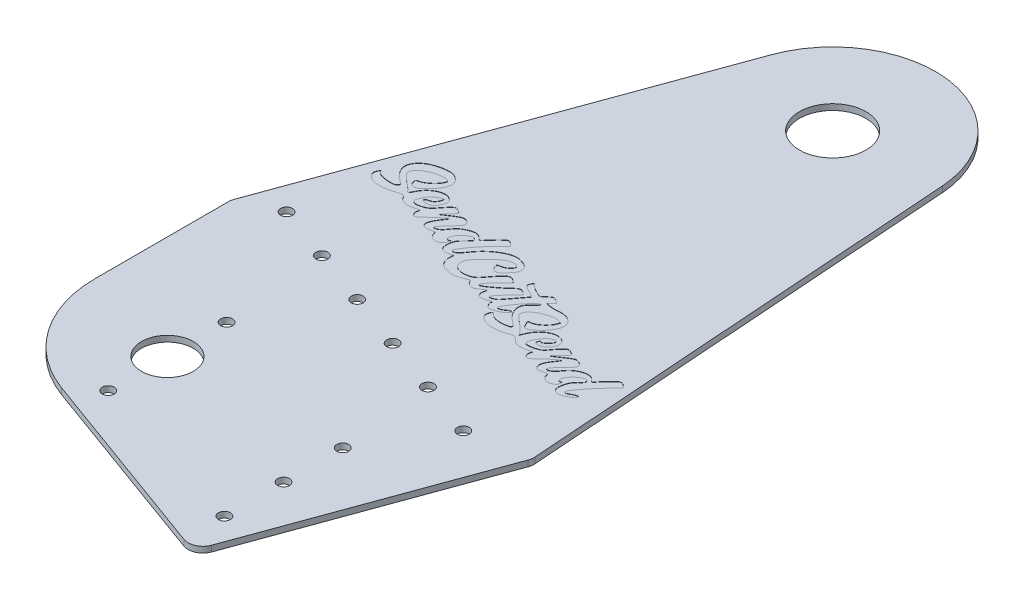
from build123d import *

# Parameters (mm, degrees)
SKETCH1_R                  = 14.2875
SKETCH1_R_2                = 11.1125
SKETCH1_R_3                = 2.5527
BOSS_EXTRUDE1_DEPTH        = 2.54
F_7_0_201_DIAMETER_HOLE1_D = 5.1054
CUT_EXTRUDE1_DEPTH         = 0.127


with BuildPart() as part:
    # Sketch1 → Boss-Extrude1 (new body)
    with BuildSketch(Plane(origin=(0, 0, 0), x_dir=(1, 0, 0), z_dir=(0, 1, 0))):
        with BuildLine():
            Line((0, 79.961539901), (0, 137.226043439))
            ThreePointArc((0, 137.226043439), (0.096470768, 138.328709367), (0.382951858, 139.397871349))
            Line((0.382951858, 139.397871349), (8.68731164, 162.213912335))
            Line((8.68731164, 162.213912335), (61.897095438, 308.406591813))
            ThreePointArc((61.897095438, 308.406591813), (109.5024689, 337.025784939), (147.412775028, 296.428513026))
            Line((147.412775028, 296.428513026), (160.751422837, 108.18172413))
            ThreePointArc((160.751422837, 108.18172413), (160.705914605, 106.852067788), (160.384352079, 105.56107804))
            Line((160.384352079, 105.56107804), (124.135089685, 5.967048142))
            ThreePointArc((124.135089685, 5.967048142), (120.851667505, 2.383821604), (115.996213633, 2.17182791))
            Line((115.996213633, 2.17182791), (33.425376719, 32.225154765))
            ThreePointArc((33.425376719, 32.225154765), (9.18707615, 50.823856935), (0, 79.961539901))
        make_face()
        with Locations((103.379027621, 293.308403239)):
            Circle(SKETCH1_R, mode=Mode.SUBTRACT)
        with Locations((44.45, 66.621712158)):
            Circle(SKETCH1_R_2, mode=Mode.SUBTRACT)
        with Locations((44.45, 92.021712158)):
            Circle(SKETCH1_R_3, mode=Mode.SUBTRACT)
        with Locations((44.45, 41.221712158)):
            Circle(SKETCH1_R_3, mode=Mode.SUBTRACT)
    extrude(amount=BOSS_EXTRUDE1_DEPTH)

    # #7 (0.201) Diameter Hole1 (through all)
    with Locations(Plane(origin=(0, 0, 0), x_dir=(-1, 0, 0), z_dir=(0, -1, 0))):
        with Locations((-135.618714944, 102.499602028), (-111.750522376, 111.186913669), (-87.882329808, 119.874225309), (-64.01413724, 128.56153695), (-40.145944672, 137.24884859), (-16.277752104, 145.936160231), (-116.079027621, 70.264108059), (-116.079027621, 44.864108059), (-116.079027621, 19.464108059)):
            Hole(F_7_0_201_DIAMETER_HOLE1_D / 2)

    # Sketch7 → Cut-Extrude1 (cut)
    with BuildSketch(Plane(origin=(0, 2.54, 0), x_dir=(1, 0, 0), z_dir=(0, 1, 0))):
        with BuildLine():
            Line((62.076099499, 169.389914878), (62.514373765, 170.567044095))
            Line((62.514373765, 170.567044095), (61.586655178, 170.262230462))
            ThreePointArc((61.586655178, 170.262230462), (60.985434818, 170.31702595), (60.613751656, 170.792757066))
            ThreePointArc((60.613751656, 170.792757066), (60.559055711, 171.624223937), (60.815399545, 172.417077419))
            ThreePointArc((60.815399545, 172.417077419), (61.639993866, 173.691529448), (62.639781612, 174.833723929))
            ThreePointArc((62.639781612, 174.833723929), (63.679633812, 175.661233826), (64.871791681, 176.248451709))
            ThreePointArc((64.871791681, 176.248451709), (65.099079856, 176.328434352), (65.328232899, 176.402905959))
            ThreePointArc((65.328232899, 176.402905959), (65.537680332, 176.464533249), (65.748990567, 176.519434385))
            ThreePointArc((65.748990567, 176.519434385), (65.925606026, 176.559822305), (66.103240098, 176.595464145))
            ThreePointArc((66.103240098, 176.595464145), (66.178363518, 176.599313759), (66.251843252, 176.583217908))
            ThreePointArc((66.251843252, 176.583217908), (66.357924451, 176.524027953), (66.440024115, 176.434494066))
            ThreePointArc((66.440024115, 176.434494066), (66.590015709, 176.197743003), (66.731621066, 175.955882575))
            ThreePointArc((66.731621066, 175.955882575), (66.865503468, 175.708537233), (66.991385724, 175.457026055))
            ThreePointArc((66.991385724, 175.457026055), (67.017480864, 175.354291121), (67.00166206, 175.249480871))
            ThreePointArc((67.00166206, 175.249480871), (66.987526619, 175.22046471), (66.967691046, 175.195003006))
            Line((66.967691046, 175.195003006), (66.479583473, 174.688563774))
            ThreePointArc((66.479583473, 174.688563774), (66.201240536, 174.401518397), (65.921664435, 174.115673959))
            ThreePointArc((65.921664435, 174.115673959), (65.593555134, 173.782552464), (65.264545463, 173.450320196))
            ThreePointArc((65.264545463, 173.450320196), (64.65377447, 172.811457395), (64.067657057, 172.149903722))
            ThreePointArc((64.067657057, 172.149903722), (63.717771309, 171.683587036), (63.428601059, 171.177373787))
            ThreePointArc((63.428601059, 171.177373787), (63.215744133, 170.658844758), (63.0742109, 170.116489922))
            ThreePointArc((63.0742109, 170.116489922), (62.944743941, 169.332574448), (62.853767959, 168.543265552))
            ThreePointArc((62.853767959, 168.543265552), (62.842100531, 167.636825959), (62.97036833, 166.739431824))
            ThreePointArc((62.97036833, 166.739431824), (63.232071984, 166.091038495), (63.688945889, 165.561728618))
            ThreePointArc((63.688945889, 165.561728618), (64.290700289, 165.209453488), (64.974100017, 165.070994336))
            ThreePointArc((64.974100017, 165.070994336), (65.87566197, 165.109953656), (66.760144194, 165.288903312))
            ThreePointArc((66.760144194, 165.288903312), (67.04136363, 165.366968009), (67.323658905, 165.441048003))
            ThreePointArc((67.323658905, 165.441048003), (67.562615268, 165.498966516), (67.802868438, 165.55124569))
            ThreePointArc((67.802868438, 165.55124569), (68.002078645, 165.591015118), (68.201710329, 165.628611723))
            ThreePointArc((68.201710329, 165.628611723), (68.234260975, 165.622293852), (68.253909944, 165.595584713))
            ThreePointArc((68.253909944, 165.595584713), (68.261610424, 165.555018283), (68.26322337, 165.513758969))
            ThreePointArc((68.26322337, 165.513758969), (68.256279887, 165.326490131), (68.248634533, 165.139248634))
            ThreePointArc((68.248634533, 165.139248634), (68.238353175, 164.919063126), (68.2263207, 164.698966365))
            ThreePointArc((68.2263207, 164.698966365), (68.210944201, 164.448389799), (68.19421696, 164.197899776))
            ThreePointArc((68.19421696, 164.197899776), (68.187930606, 163.572595343), (68.25570298, 162.950942662))
            ThreePointArc((68.25570298, 162.950942662), (68.398465468, 162.310034794), (68.606068614, 161.687102249))
            ThreePointArc((68.606068614, 161.687102249), (68.866428087, 161.113452111), (69.186141219, 160.570639944))
            ThreePointArc((69.186141219, 160.570639944), (69.525559026, 160.137603462), (69.92917637, 159.763680902))
            ThreePointArc((69.92917637, 159.763680902), (70.466971525, 159.397497396), (71.050629495, 159.10999546))
            ThreePointArc((71.050629495, 159.10999546), (71.823044361, 158.825820547), (72.613497718, 158.596553024))
            ThreePointArc((72.613497718, 158.596553024), (73.43584942, 158.41929053), (74.268555418, 158.299770517))
            ThreePointArc((74.268555418, 158.299770517), (74.978307796, 158.26418709), (75.687446785, 158.310409525))
            ThreePointArc((75.687446785, 158.310409525), (76.037646073, 158.362788338), (76.384679393, 158.433151371))
            ThreePointArc((76.384679393, 158.433151371), (76.847607887, 158.544808994), (77.308005626, 158.666481252))
            ThreePointArc((77.308005626, 158.666481252), (77.798827363, 158.807573323), (78.286518059, 158.959134316))
            ThreePointArc((78.286518059, 158.959134316), (78.731971317, 159.109578951), (79.173136741, 159.272168193))
            Line((79.173136741, 159.272168193), (81.212299551, 160.055577712))
            Line((81.212299551, 160.055577712), (81.563880431, 159.301610082))
            ThreePointArc((81.563880431, 159.301610082), (81.7858593, 158.91888467), (82.072263984, 158.581652235))
            ThreePointArc((82.072263984, 158.581652235), (82.441698725, 158.263763464), (82.85025398, 157.998023172))
            ThreePointArc((82.85025398, 157.998023172), (83.274383921, 157.798102658), (83.722059966, 157.658673185))
            ThreePointArc((83.722059966, 157.658673185), (84.113032151, 157.612820033), (84.504080666, 157.658017586))
            ThreePointArc((84.504080666, 157.658017586), (84.704717825, 157.716644143), (84.897976847, 157.796288937))
            ThreePointArc((84.897976847, 157.796288937), (85.190157795, 157.940782054), (85.477858023, 158.09400263))
            ThreePointArc((85.477858023, 158.09400263), (85.799871894, 158.278112061), (86.116229495, 158.471779517))
            ThreePointArc((86.116229495, 158.471779517), (86.425022263, 158.673917098), (86.727482456, 158.88541274))
            ThreePointArc((86.727482456, 158.88541274), (87.010268624, 159.085729074), (87.296697387, 159.280801403))
            ThreePointArc((87.296697387, 159.280801403), (87.551055536, 159.445614583), (87.809847455, 159.603374512))
            ThreePointArc((87.809847455, 159.603374512), (88.025908058, 159.728525444), (88.244111159, 159.849902321))
            ThreePointArc((88.244111159, 159.849902321), (88.311309966, 159.870360992), (88.381119582, 159.862560067))
            ThreePointArc((88.381119582, 159.862560067), (88.424417108, 159.831307094), (88.441443645, 159.780695621))
            ThreePointArc((88.441443645, 159.780695621), (88.438680387, 159.659394972), (88.427011598, 159.538625264))
            ThreePointArc((88.427011598, 159.538625264), (88.400044033, 159.378215621), (88.362408415, 159.219968778))
            ThreePointArc((88.362408415, 159.219968778), (88.308041388, 159.036094227), (88.246173408, 158.854605998))
            ThreePointArc((88.246173408, 158.854605998), (88.175764463, 158.628210163), (88.127170775, 158.396151663))
            ThreePointArc((88.127170775, 158.396151663), (88.098728957, 158.152181729), (88.091257596, 157.906673186))
            ThreePointArc((88.091257596, 157.906673186), (88.104822915, 157.659437476), (88.139289533, 157.414240481))
            ThreePointArc((88.139289533, 157.414240481), (88.194014788, 157.177184715), (88.269735862, 156.945977862))
            ThreePointArc((88.269735862, 156.945977862), (88.380437253, 156.679086332), (88.507919452, 156.419790794))
            ThreePointArc((88.507919452, 156.419790794), (88.615909536, 156.257826396), (88.753714773, 156.120334429))
            ThreePointArc((88.753714773, 156.120334429), (88.915784478, 156.012693649), (89.095825489, 155.938948406))
            ThreePointArc((89.095825489, 155.938948406), (89.376240848, 155.864830339), (89.660777024, 155.808568217))
            ThreePointArc((89.660777024, 155.808568217), (89.907920432, 155.781557113), (90.156535471, 155.781719803))
            ThreePointArc((90.156535471, 155.781719803), (90.485680573, 155.80787544), (90.813201085, 155.849719552))
            ThreePointArc((90.813201085, 155.849719552), (91.163543927, 155.911391039), (91.510635431, 155.98930745))
            ThreePointArc((91.510635431, 155.98930745), (91.830199709, 156.078714611), (92.144110277, 156.186302363))
            ThreePointArc((92.144110277, 156.186302363), (92.681338675, 156.383695853), (93.221187384, 156.573806124))
            ThreePointArc((93.221187384, 156.573806124), (93.434095585, 156.628177121), (93.653016441, 156.647144616))
            ThreePointArc((93.653016441, 156.647144616), (93.754036745, 156.609731345), (93.805444538, 156.515063011))
            ThreePointArc((93.805444538, 156.515063011), (93.808105803, 156.352363177), (93.771443442, 156.193825518))
            ThreePointArc((93.771443442, 156.193825518), (93.715659786, 155.904517852), (93.752887622, 155.612242588))
            ThreePointArc((93.752887622, 155.612242588), (93.896843837, 155.202262562), (94.08290181, 154.809592925))
            ThreePointArc((94.08290181, 154.809592925), (94.313870713, 154.430567244), (94.583212677, 154.077775509))
            ThreePointArc((94.583212677, 154.077775509), (94.823690403, 153.859504625), (95.111996182, 153.710000468))
            ThreePointArc((95.111996182, 153.710000468), (95.607872144, 153.593770139), (96.117173812, 153.597547578))
            ThreePointArc((96.117173812, 153.597547578), (96.843705893, 153.720307082), (97.557690249, 153.902365033))
            ThreePointArc((97.557690249, 153.902365033), (98.335046392, 154.168977084), (99.088878044, 154.496242111))
            ThreePointArc((99.088878044, 154.496242111), (99.773408406, 154.866460909), (100.420507831, 155.298787301))
            ThreePointArc((100.420507831, 155.298787301), (100.716452806, 155.524575924), (101.004960086, 155.759793865))
            ThreePointArc((101.004960086, 155.759793865), (101.250782645, 155.97699109), (101.48611788, 156.205509562))
            ThreePointArc((101.48611788, 156.205509562), (101.665501212, 156.395781806), (101.836888038, 156.593287407))
            ThreePointArc((101.836888038, 156.593287407), (101.884060405, 156.686280792), (101.886160455, 156.790533329))
            ThreePointArc((101.886160455, 156.790533329), (101.81113355, 156.983449256), (101.677199582, 157.14126967))
            ThreePointArc((101.677199582, 157.14126967), (101.505007354, 157.237514751), (101.309348253, 157.262630389))
            ThreePointArc((101.309348253, 157.262630389), (101.037569291, 157.21498634), (100.782780536, 157.109078598))
            ThreePointArc((100.782780536, 157.109078598), (100.450500741, 156.907569441), (100.135844533, 156.679518408))
            ThreePointArc((100.135844533, 156.679518408), (99.724983312, 156.380037844), (99.292414052, 156.112868635))
            ThreePointArc((99.292414052, 156.112868635), (98.844251929, 155.881976338), (98.379358973, 155.686950495))
            ThreePointArc((98.379358973, 155.686950495), (97.986884432, 155.557588707), (97.585414162, 155.459648117))
            ThreePointArc((97.585414162, 155.459648117), (97.387336486, 155.474704309), (97.22647781, 155.591263053))
            ThreePointArc((97.22647781, 155.591263053), (97.073438636, 155.972384191), (97.151320841, 156.375631847))
            ThreePointArc((97.151320841, 156.375631847), (97.711080171, 157.407320056), (98.311678059, 158.415780886))
            ThreePointArc((98.311678059, 158.415780886), (99.130040127, 159.662563501), (100.006520267, 160.869197633))
            ThreePointArc((100.006520267, 160.869197633), (101.072241046, 162.221774298), (102.179192847, 163.540820213))
            ThreePointArc((102.179192847, 163.540820213), (102.84356579, 164.298754642), (103.517113714, 165.048547413))
            ThreePointArc((103.517113714, 165.048547413), (103.884004143, 165.423555591), (104.277261584, 165.77081386))
            ThreePointArc((104.277261584, 165.77081386), (104.534381399, 165.949071167), (104.816796154, 166.083712069))
            ThreePointArc((104.816796154, 166.083712069), (105.05023939, 166.127613774), (105.284320675, 166.087252201))
            ThreePointArc((105.284320675, 166.087252201), (105.351659622, 166.02133717), (105.346459612, 165.927250588))
            ThreePointArc((105.346459612, 165.927250588), (105.228966793, 165.724553402), (105.093938218, 165.533090623))
            ThreePointArc((105.093938218, 165.533090623), (104.848307764, 165.232899017), (104.586793218, 164.946438789))
            ThreePointArc((104.586793218, 164.946438789), (104.173603076, 164.524654833), (103.753608968, 164.109645497))
            ThreePointArc((103.753608968, 164.109645497), (103.049424787, 163.39758697), (102.373776531, 162.658396777))
            ThreePointArc((102.373776531, 162.658396777), (101.989554803, 162.152235076), (101.681460774, 161.596443683))
            ThreePointArc((101.681460774, 161.596443683), (101.505079191, 161.093387977), (101.429381832, 160.565708703))
            ThreePointArc((101.429381832, 160.565708703), (101.436881761, 159.925999415), (101.516888319, 159.291268629))
            ThreePointArc((101.516888319, 159.291268629), (101.712260535, 158.518519555), (102.006780565, 157.777864855))
            ThreePointArc((102.006780565, 157.777864855), (102.418510136, 157.014758189), (102.905634033, 156.297427489))
            ThreePointArc((102.905634033, 156.297427489), (103.545814214, 155.521894306), (104.249740812, 154.803723208))
            ThreePointArc((104.249740812, 154.803723208), (105.148760412, 154.002786367), (106.086684632, 153.247780257))
            ThreePointArc((106.086684632, 153.247780257), (106.643076504, 152.78422981), (107.158763253, 152.275783048))
            ThreePointArc((107.158763253, 152.275783048), (107.302662315, 151.970761825), (107.242679003, 151.638877977))
            ThreePointArc((107.242679003, 151.638877977), (106.985390772, 151.336449321), (106.625012421, 151.169752677))
            ThreePointArc((106.625012421, 151.169752677), (105.72515923, 150.99386554), (104.817927042, 150.861193732))
            ThreePointArc((104.817927042, 150.861193732), (103.87665349, 150.78105085), (102.93204479, 150.7695102))
            ThreePointArc((102.93204479, 150.7695102), (102.076114542, 150.831742405), (101.230216237, 150.976467991))
            ThreePointArc((101.230216237, 150.976467991), (100.514797012, 151.177390219), (99.826264326, 151.456884674))
            ThreePointArc((99.826264326, 151.456884674), (99.295254596, 151.773539428), (98.834592795, 152.185889125))
            ThreePointArc((98.834592795, 152.185889125), (98.552759387, 152.472909033), (98.253253444, 152.741435916))
            ThreePointArc((98.253253444, 152.741435916), (98.086978421, 152.821730169), (97.902549393, 152.812758882))
            ThreePointArc((97.902549393, 152.812758882), (97.728552417, 152.716259907), (97.60855714, 152.55755221))
            ThreePointArc((97.60855714, 152.55755221), (97.420718054, 152.132837525), (97.252129042, 151.700120723))
            ThreePointArc((97.252129042, 151.700120723), (97.120424975, 150.565164824), (97.513877685, 149.492473899))
            ThreePointArc((97.513877685, 149.492473899), (98.408438388, 148.50652004), (99.556768109, 147.832960305))
            ThreePointArc((99.556768109, 147.832960305), (101.308303959, 147.323477375), (103.124764291, 147.156376954))
            ThreePointArc((103.124764291, 147.156376954), (105.245384828, 147.294030918), (107.333578758, 147.688272195))
            ThreePointArc((107.333578758, 147.688272195), (107.725435366, 147.790413186), (108.115716391, 147.898418298))
            ThreePointArc((108.115716391, 147.898418298), (108.487933307, 148.007879151), (108.858227012, 148.123679339))
            ThreePointArc((108.858227012, 148.123679339), (109.170509291, 148.226990027), (109.481128247, 148.335199014))
            ThreePointArc((109.481128247, 148.335199014), (109.640411583, 148.400591836), (109.792936824, 148.480488349))
            ThreePointArc((109.792936824, 148.480488349), (110.158362903, 148.638407948), (110.550997631, 148.704079779))
            ThreePointArc((110.550997631, 148.704079779), (110.999125007, 148.685902264), (111.43768483, 148.592020158))
            ThreePointArc((111.43768483, 148.592020158), (111.891154812, 148.414255605), (112.311725267, 148.168581526))
            ThreePointArc((112.311725267, 148.168581526), (112.696235589, 147.857436079), (113.030584263, 147.492921826))
            ThreePointArc((113.030584263, 147.492921826), (113.516831783, 146.980166752), (114.087617379, 146.563563562))
            ThreePointArc((114.087617379, 146.563563562), (114.742714912, 146.241018694), (115.441794807, 146.030127086))
            ThreePointArc((115.441794807, 146.030127086), (116.248690267, 145.917044808), (117.063465472, 145.92008631))
            ThreePointArc((117.063465472, 145.92008631), (117.991499847, 146.03453308), (118.904500074, 146.236464873))
            ThreePointArc((118.904500074, 146.236464873), (119.297661297, 146.341504028), (119.691667626, 146.443327325))
            ThreePointArc((119.691667626, 146.443327325), (120.035021937, 146.5282979), (120.379405753, 146.608994675))
            ThreePointArc((120.379405753, 146.608994675), (120.673320865, 146.675133892), (120.967577729, 146.739735648))
            ThreePointArc((120.967577729, 146.739735648), (121.024521021, 146.743891795), (121.080380151, 146.732077835))
            ThreePointArc((121.080380151, 146.732077835), (121.112505525, 146.706664237), (121.123079645, 146.667090526))
            ThreePointArc((121.123079645, 146.667090526), (121.113780348, 146.559677634), (121.098643601, 146.452930807))
            ThreePointArc((121.098643601, 146.452930807), (121.07098753, 146.313741898), (121.035576636, 146.176321088))
            ThreePointArc((121.035576636, 146.176321088), (120.986573854, 146.016456643), (120.932098511, 145.858373279))
            ThreePointArc((120.932098511, 145.858373279), (120.837360998, 145.489763963), (120.815840825, 145.109783824))
            ThreePointArc((120.815840825, 145.109783824), (120.866288682, 144.717472677), (120.983868221, 144.339811355))
            ThreePointArc((120.983868221, 144.339811355), (121.160273571, 144.000288698), (121.394848413, 143.698015434))
            ThreePointArc((121.394848413, 143.698015434), (121.661791467, 143.471981185), (121.974137022, 143.314531733))
            ThreePointArc((121.974137022, 143.314531733), (122.191255905, 143.27080428), (122.411585207, 143.293336446))
            ThreePointArc((122.411585207, 143.293336446), (122.666552514, 143.382514468), (122.902959636, 143.513177088))
            ThreePointArc((122.902959636, 143.513177088), (123.258014552, 143.771039957), (123.591900519, 144.055780914))
            ThreePointArc((123.591900519, 144.055780914), (124.205225206, 144.629089171), (124.810961758, 145.210409014))
            ThreePointArc((124.810961758, 145.210409014), (125.635334133, 145.988621079), (126.482379095, 146.742092154))
            ThreePointArc((126.482379095, 146.742092154), (127.433022204, 147.544412744), (128.401415584, 148.325216761))
            ThreePointArc((128.401415584, 148.325216761), (129.340999876, 149.05981006), (130.286125134, 149.787260541))
            ThreePointArc((130.286125134, 149.787260541), (130.428120067, 149.816862578), (130.540190561, 149.724780841))
            ThreePointArc((130.540190561, 149.724780841), (130.54915896, 149.678093587), (130.534959016, 149.632722964))
            ThreePointArc((130.534959016, 149.632722964), (130.380262306, 149.382226807), (130.223884804, 149.132776463))
            ThreePointArc((130.223884804, 149.132776463), (130.036067178, 148.841001036), (129.843247508, 148.552506779))
            ThreePointArc((129.843247508, 148.552506779), (129.613486233, 148.218988797), (129.380109321, 147.887990754))
            ThreePointArc((129.380109321, 147.887990754), (128.803092446, 147.033618331), (128.27048311, 146.150879408))
            ThreePointArc((128.27048311, 146.150879408), (127.895820956, 145.410994732), (127.594715563, 144.638248587))
            ThreePointArc((127.594715563, 144.638248587), (127.428110444, 144.009827214), (127.342845277, 143.365311474))
            ThreePointArc((127.342845277, 143.365311474), (127.372858534, 142.851054772), (127.530162234, 142.360528222))
            ThreePointArc((127.530162234, 142.360528222), (127.743377535, 141.978324248), (128.009594669, 141.630949696))
            ThreePointArc((128.009594669, 141.630949696), (128.272849151, 141.410270087), (128.588685294, 141.275177741))
            ThreePointArc((128.588685294, 141.275177741), (129.003068119, 141.209884575), (129.422118811, 141.229193665))
            ThreePointArc((129.422118811, 141.229193665), (130.112073874, 141.348499995), (130.795504822, 141.500796182))
            ThreePointArc((130.795504822, 141.500796182), (131.340854328, 141.632133735), (131.887974943, 141.755886185))
            ThreePointArc((131.887974943, 141.755886185), (132.110954322, 141.787184366), (132.33610154, 141.784336659))
            ThreePointArc((132.33610154, 141.784336659), (132.47510977, 141.743288509), (132.587447099, 141.651699407))
            ThreePointArc((132.587447099, 141.651699407), (132.691105365, 141.497311977), (132.763030106, 141.325826274))
            ThreePointArc((132.763030106, 141.325826274), (132.799309063, 141.201126834), (132.831341733, 141.075269688))
            ThreePointArc((132.831341733, 141.075269688), (132.857559922, 140.953957695), (132.879045209, 140.831718685))
            ThreePointArc((132.879045209, 140.831718685), (132.893187091, 140.728099081), (132.903399618, 140.624018729))
            ThreePointArc((132.903399618, 140.624018729), (132.902402893, 140.565828987), (132.89031835, 140.508899175))
            ThreePointArc((132.89031835, 140.508899175), (132.88403432, 140.448738527), (132.901802285, 140.390919049))
            ThreePointArc((132.901802285, 140.390919049), (132.972760394, 140.267087378), (133.048878371, 140.146358799))
            ThreePointArc((133.048878371, 140.146358799), (133.150312005, 140.000349967), (133.258503186, 139.859275414))
            ThreePointArc((133.258503186, 139.859275414), (133.38618993, 139.705960386), (133.518918559, 139.556988867))
            ThreePointArc((133.518918559, 139.556988867), (133.883912329, 139.221748466), (134.299490846, 138.951746476))
            ThreePointArc((134.299490846, 138.951746476), (134.738976146, 138.766257322), (135.205264922, 138.665617709))
            ThreePointArc((135.205264922, 138.665617709), (135.714708551, 138.648358864), (136.219686472, 138.717842513))
            ThreePointArc((136.219686472, 138.717842513), (136.779359384, 138.878487417), (137.316911747, 139.10226858))
            ThreePointArc((137.316911747, 139.10226858), (137.672278656, 139.28361384), (138.020147338, 139.478957443))
            ThreePointArc((138.020147338, 139.478957443), (138.214734471, 139.616723249), (138.383376821, 139.785256116))
            ThreePointArc((138.383376821, 139.785256116), (138.507214208, 139.965861807), (138.592633253, 140.167499356))
            ThreePointArc((138.592633253, 140.167499356), (138.676354824, 140.474412062), (138.738886243, 140.786332776))
            ThreePointArc((138.738886243, 140.786332776), (138.777596283, 141.046627531), (138.807965465, 141.308026728))
            ThreePointArc((138.807965465, 141.308026728), (138.809051652, 141.447230947), (138.784685445, 141.584290359))
            ThreePointArc((138.784685445, 141.584290359), (138.745048863, 141.651198822), (138.676875391, 141.688617785))
            ThreePointArc((138.676875391, 141.688617785), (138.585042426, 141.694793904), (138.496299921, 141.67037658))
            ThreePointArc((138.496299921, 141.67037658), (138.245223556, 141.585322888), (137.981654009, 141.556958025))
            ThreePointArc((137.981654009, 141.556958025), (137.746132159, 141.593136163), (137.531802951, 141.69726296))
            ThreePointArc((137.531802951, 141.69726296), (137.360364669, 141.858574596), (137.245409363, 142.063995642))
            ThreePointArc((137.245409363, 142.063995642), (137.18320656, 142.315734486), (137.180101878, 142.575025818))
            ThreePointArc((137.180101878, 142.575025818), (137.318540497, 143.243918965), (137.588269285, 143.871477468))
            ThreePointArc((137.588269285, 143.871477468), (138.048267581, 144.611142741), (138.579131623, 145.301712446))
            ThreePointArc((138.579131623, 145.301712446), (139.224928904, 145.992508541), (139.932530151, 146.619847242))
            ThreePointArc((139.932530151, 146.619847242), (140.663482607, 147.146469272), (141.447089395, 147.590971978))
            ThreePointArc((141.447089395, 147.590971978), (141.872271249, 147.782255207), (142.311086237, 147.93976803))
            ThreePointArc((142.311086237, 147.93976803), (142.630008443, 148.002843003), (142.955003685, 147.994601769))
            ThreePointArc((142.955003685, 147.994601769), (143.20423146, 147.918838999), (143.417138064, 147.768754825))
            ThreePointArc((143.417138064, 147.768754825), (143.602089362, 147.541857009), (143.731276534, 147.279177973))
            ThreePointArc((143.731276534, 147.279177973), (143.769430929, 147.102790992), (143.760730689, 146.922534423))
            ThreePointArc((143.760730689, 146.922534423), (143.706341112, 146.732608649), (143.615285256, 146.557283645))
            ThreePointArc((143.615285256, 146.557283645), (143.435526815, 146.309397921), (143.23267276, 146.08002778))
            ThreePointArc((143.23267276, 146.08002778), (142.830658796, 145.674592106), (142.421668394, 145.276195114))
            ThreePointArc((142.421668394, 145.276195114), (142.049761052, 144.907611824), (141.690834097, 144.526376788))
            ThreePointArc((141.690834097, 144.526376788), (141.406907884, 144.194880868), (141.143163573, 143.847112873))
            ThreePointArc((141.143163573, 143.847112873), (140.925300595, 143.518409075), (140.730159599, 143.175727801))
            ThreePointArc((140.730159599, 143.175727801), (140.558754173, 142.821014031), (140.411620314, 142.455564574))
            ThreePointArc((140.411620314, 142.455564574), (140.000754527, 141.089005923), (139.748020584, 139.684577642))
            ThreePointArc((139.748020584, 139.684577642), (139.77462793, 138.657888358), (140.097521147, 137.68293256))
            ThreePointArc((140.097521147, 137.68293256), (140.617787708, 137.039476121), (141.357571381, 136.668755742))
            ThreePointArc((141.357571381, 136.668755742), (142.34158636, 136.545808903), (143.324901769, 136.674230896))
            ThreePointArc((143.324901769, 136.674230896), (143.930823572, 136.866099184), (144.514705648, 137.117169677))
            ThreePointArc((144.514705648, 137.117169677), (145.230560932, 137.490228301), (145.927205287, 137.898037283))
            ThreePointArc((145.927205287, 137.898037283), (146.567178533, 138.312514771), (147.189611838, 138.752894295))
            ThreePointArc((147.189611838, 138.752894295), (147.450320588, 139.012164188), (147.625121538, 139.335636841))
            ThreePointArc((147.625121538, 139.335636841), (147.66831646, 139.580039315), (147.625508861, 139.824509927))
            ThreePointArc((147.625508861, 139.824509927), (147.503357877, 139.981601939), (147.312279747, 140.037170916))
            ThreePointArc((147.312279747, 140.037170916), (146.92809182, 139.988948235), (146.559791781, 139.869445636))
            ThreePointArc((146.559791781, 139.869445636), (145.919183771, 139.578507829), (145.28953141, 139.264563035))
            ThreePointArc((145.28953141, 139.264563035), (144.757539042, 138.992974164), (144.22094649, 138.730591183))
            ThreePointArc((144.22094649, 138.730591183), (143.922050443, 138.604340218), (143.612717838, 138.506404054))
            ThreePointArc((143.612717838, 138.506404054), (143.429336658, 138.478951945), (143.244425211, 138.492737159))
            ThreePointArc((143.244425211, 138.492737159), (143.113889341, 138.550874973), (143.023413568, 138.661481271))
            ThreePointArc((143.023413568, 138.661481271), (142.91191489, 139.241621041), (143.106379668, 139.799453954))
            ThreePointArc((143.106379668, 139.799453954), (144.286575141, 141.488273337), (145.50646037, 143.148650492))
            ThreePointArc((145.50646037, 143.148650492), (146.980693912, 145.031699337), (148.524436393, 146.858197803))
            ThreePointArc((148.524436393, 146.858197803), (150.184655417, 148.685845904), (151.906041971, 150.456002145))
            ThreePointArc((151.906041971, 150.456002145), (152.504712321, 151.05737518), (153.096993047, 151.665042242))
            ThreePointArc((153.096993047, 151.665042242), (153.389903577, 151.989224041), (153.661121274, 152.331760723))
            ThreePointArc((153.661121274, 152.331760723), (153.792302325, 152.53993542), (153.89094745, 152.765355721))
            ThreePointArc((153.89094745, 152.765355721), (153.90512711, 152.924465028), (153.841665685, 153.071057941))
            ThreePointArc((153.841665685, 153.071057941), (153.63076883, 153.307554056), (153.388535752, 153.511835802))
            ThreePointArc((153.388535752, 153.511835802), (153.034906948, 153.75383123), (152.667620166, 153.9745472))
            ThreePointArc((152.667620166, 153.9745472), (152.299035602, 154.167935516), (151.920065442, 154.340084405))
            ThreePointArc((151.920065442, 154.340084405), (151.667742237, 154.416522646), (151.405080505, 154.43929586))
            ThreePointArc((151.405080505, 154.43929586), (151.107033916, 154.380132563), (150.848489758, 154.220486129))
            ThreePointArc((150.848489758, 154.220486129), (150.045484913, 153.488321327), (149.253554949, 152.744191627))
            ThreePointArc((149.253554949, 152.744191627), (148.412258991, 151.919459439), (147.593814846, 151.072044988))
            ThreePointArc((147.593814846, 151.072044988), (146.861074406, 150.264879087), (146.156594083, 149.432933886))
            ThreePointArc((146.156594083, 149.432933886), (145.799826775, 149.012010308), (145.428383475, 148.603979125))
            ThreePointArc((145.428383475, 148.603979125), (145.233235441, 148.450619015), (145.001743187, 148.361101335))
            ThreePointArc((145.001743187, 148.361101335), (144.804298959, 148.366712064), (144.633488365, 148.465906036))
            ThreePointArc((144.633488365, 148.465906036), (144.402784663, 148.718365182), (144.201416649, 148.994790112))
            ThreePointArc((144.201416649, 148.994790112), (143.893819361, 149.366783603), (143.508494648, 149.657507036))
            ThreePointArc((143.508494648, 149.657507036), (143.005365737, 149.903183673), (142.471047773, 150.070515752))
            ThreePointArc((142.471047773, 150.070515752), (141.847143727, 150.17256117), (141.215236443, 150.191606156))
            ThreePointArc((141.215236443, 150.191606156), (140.544397774, 150.130740879), (139.8841922, 149.997108165))
            ThreePointArc((139.8841922, 149.997108165), (139.076782429, 149.74477526), (138.297656698, 149.415312775))
            ThreePointArc((138.297656698, 149.415312775), (137.547232874, 149.007701472), (136.840246687, 148.528688505))
            ThreePointArc((136.840246687, 148.528688505), (136.143749993, 147.954086887), (135.502156046, 147.318766597))
            ThreePointArc((135.502156046, 147.318766597), (134.847038506, 146.559396239), (134.243649891, 145.758306662))
            ThreePointArc((134.243649891, 145.758306662), (133.893244575, 145.273954818), (133.529532139, 144.799514244))
            ThreePointArc((133.529532139, 144.799514244), (133.245270633, 144.463255266), (132.938900504, 144.14700845))
            ThreePointArc((132.938900504, 144.14700845), (132.668863383, 143.908783705), (132.378720527, 143.695504077))
            ThreePointArc((132.378720527, 143.695504077), (132.083061832, 143.518862205), (131.770999635, 143.373144673))
            ThreePointArc((131.770999635, 143.373144673), (131.251102987, 143.231020131), (130.7123491, 143.215652636))
            ThreePointArc((130.7123491, 143.215652636), (130.456459221, 143.376064517), (130.434657545, 143.677289166))
            ThreePointArc((130.434657545, 143.677289166), (130.79629879, 144.373155677), (131.266993719, 145.000420274))
            ThreePointArc((131.266993719, 145.000420274), (132.330651746, 146.169433975), (133.422645412, 147.312023693))
            ThreePointArc((133.422645412, 147.312023693), (134.334576492, 148.260561838), (135.228722139, 149.22588379))
            ThreePointArc((135.228722139, 149.22588379), (135.670578435, 149.76697259), (136.052634617, 150.351820561))
            ThreePointArc((136.052634617, 150.351820561), (136.222271275, 150.746269165), (136.293749123, 151.169656946))
            ThreePointArc((136.293749123, 151.169656946), (136.24891505, 151.551653984), (136.082974398, 151.898634577))
            ThreePointArc((136.082974398, 151.898634577), (135.842309839, 152.185418226), (135.555407376, 152.425941132))
            ThreePointArc((135.555407376, 152.425941132), (135.174655315, 152.664106697), (134.771529919, 152.862058418))
            ThreePointArc((134.771529919, 152.862058418), (134.349950544, 153.017909899), (133.914671256, 153.12994023))
            ThreePointArc((133.914671256, 153.12994023), (133.539517988, 153.173283696), (133.162472776, 153.15194036))
            ThreePointArc((133.162472776, 153.15194036), (132.967401977, 153.105618875), (132.783906264, 153.024825186))
            ThreePointArc((132.783906264, 153.024825186), (132.320523031, 152.763926317), (131.860956605, 152.496361483))
            ThreePointArc((131.860956605, 152.496361483), (131.314576086, 152.165822299), (130.774642484, 151.824853783))
            ThreePointArc((130.774642484, 151.824853783), (130.186534276, 151.439485158), (129.604043274, 151.045677497))
            ThreePointArc((129.604043274, 151.045677497), (129.0380303, 150.659002789), (128.470194026, 150.275010623))
            ThreePointArc((128.470194026, 150.275010623), (127.985533996, 149.951630549), (127.498404455, 149.631982576))
            ThreePointArc((127.498404455, 149.631982576), (127.069171885, 149.35312271), (126.639533754, 149.074888097))
            ThreePointArc((126.639533754, 149.074888097), (126.601736189, 149.061381298), (126.561878385, 149.066118917))
            ThreePointArc((126.561878385, 149.066118917), (126.519441608, 149.112579103), (126.533354922, 149.173945614))
            ThreePointArc((126.533354922, 149.173945614), (126.776839878, 149.455616663), (127.024963385, 149.733210304))
            ThreePointArc((127.024963385, 149.733210304), (127.405118202, 150.143104412), (127.793458679, 150.545251822))
            ThreePointArc((127.793458679, 150.545251822), (128.443193982, 151.201436475), (129.096131622, 151.854434716))
            ThreePointArc((129.096131622, 151.854434716), (129.422147348, 152.1855279), (129.741391067, 152.523155504))
            ThreePointArc((129.741391067, 152.523155504), (130.008357891, 152.820613552), (130.265754739, 153.126390331))
            ThreePointArc((130.265754739, 153.126390331), (130.468598756, 153.380419403), (130.66631701, 153.638458077))
            ThreePointArc((130.66631701, 153.638458077), (130.696681066, 153.71693357), (130.681612317, 153.799718302))
            ThreePointArc((130.681612317, 153.799718302), (130.513805756, 154.059802226), (130.289700263, 154.273295592))
            ThreePointArc((130.289700263, 154.273295592), (129.888084675, 154.554403353), (129.469241351, 154.809132471))
            ThreePointArc((129.469241351, 154.809132471), (129.037159996, 155.035529524), (128.591630923, 155.234159252))
            ThreePointArc((128.591630923, 155.234159252), (128.308873538, 155.307936492), (128.016663681, 155.30506962))
            ThreePointArc((128.016663681, 155.30506962), (127.675515083, 155.208794621), (127.371572214, 155.026394035))
            ThreePointArc((127.371572214, 155.026394035), (126.914414526, 154.638368883), (126.481808336, 154.223147792))
            ThreePointArc((126.481808336, 154.223147792), (125.925804301, 153.627075081), (125.399927858, 153.0042612))
            ThreePointArc((125.399927858, 153.0042612), (124.740208565, 152.16351677), (124.099423449, 151.308253549))
            ThreePointArc((124.099423449, 151.308253549), (123.724228696, 150.811126337), (123.334605023, 150.325225154))
            ThreePointArc((123.334605023, 150.325225154), (123.048901317, 150.00871762), (122.736636312, 149.718382996))
            ThreePointArc((122.736636312, 149.718382996), (122.436752073, 149.489616658), (122.114110255, 149.294253277))
            ThreePointArc((122.114110255, 149.294253277), (121.711829563, 149.095530103), (121.29765337, 148.922964939))
            ThreePointArc((121.29765337, 148.922964939), (120.659304634, 148.699002971), (120.010438186, 148.507638384))
            ThreePointArc((120.010438186, 148.507638384), (119.37505065, 148.356621233), (118.732177837, 148.241564523))
            ThreePointArc((118.732177837, 148.241564523), (118.176205551, 148.175013483), (117.617253826, 148.14173898))
            ThreePointArc((117.617253826, 148.14173898), (117.243952185, 148.166056377), (116.8818991, 148.260199959))
            ThreePointArc((116.8818991, 148.260199959), (116.319932985, 148.741962649), (116.214583653, 149.47463087))
            ThreePointArc((116.214583653, 149.47463087), (116.60072466, 150.752073494), (117.177555711, 151.955497973))
            ThreePointArc((117.177555711, 151.955497973), (118.056127979, 153.278075265), (119.093145332, 154.480445812))
            ThreePointArc((119.093145332, 154.480445812), (120.071406475, 155.255083734), (121.212607105, 155.759781562))
            ThreePointArc((121.212607105, 155.759781562), (121.455803326, 155.826498165), (121.70169492, 155.882469862))
            ThreePointArc((121.70169492, 155.882469862), (121.856640009, 155.900603002), (122.012413479, 155.892152139))
            ThreePointArc((122.012413479, 155.892152139), (122.12417889, 155.859942129), (122.222560976, 155.797894107))
            ThreePointArc((122.222560976, 155.797894107), (122.310347198, 155.705418591), (122.376342165, 155.596318608))
            ThreePointArc((122.376342165, 155.596318608), (122.465799468, 155.113625285), (122.310019044, 154.648084833))
            ThreePointArc((122.310019044, 154.648084833), (121.79737103, 153.943528817), (121.213016628, 153.297202973))
            ThreePointArc((121.213016628, 153.297202973), (120.583078485, 152.736212145), (119.895254868, 152.247917722))
            ThreePointArc((119.895254868, 152.247917722), (119.473802154, 152.143525441), (119.073222089, 152.311023948))
            ThreePointArc((119.073222089, 152.311023948), (118.994620111, 152.360824369), (118.904776298, 152.385040932))
            ThreePointArc((118.904776298, 152.385040932), (118.822245122, 152.377019148), (118.750112464, 152.336121428))
            ThreePointArc((118.750112464, 152.336121428), (118.66486315, 152.243694567), (118.599791895, 152.136103201))
            ThreePointArc((118.599791895, 152.136103201), (118.513895102, 151.943669037), (118.437161537, 151.74740104))
            ThreePointArc((118.437161537, 151.74740104), (118.359078816, 151.512782829), (118.294176274, 151.274182167))
            ThreePointArc((118.294176274, 151.274182167), (118.281425769, 151.138616674), (118.307696163, 151.005011118))
            ThreePointArc((118.307696163, 151.005011118), (118.368666552, 150.896784681), (118.463039508, 150.816012811))
            ThreePointArc((118.463039508, 150.816012811), (118.63984408, 150.722389447), (118.824498663, 150.645396746))
            ThreePointArc((118.824498663, 150.645396746), (119.712133307, 150.468839232), (120.611777752, 150.567366832))
            ThreePointArc((120.611777752, 150.567366832), (121.559752733, 150.935454355), (122.406165527, 151.499130123))
            ThreePointArc((122.406165527, 151.499130123), (123.158398535, 152.269068078), (123.740963324, 153.174207415))
            ThreePointArc((123.740963324, 153.174207415), (124.100558976, 154.140488281), (124.231077365, 155.163216347))
            ThreePointArc((124.231077365, 155.163216347), (124.201819365, 155.597953864), (124.104128215, 156.022582147))
            ThreePointArc((124.104128215, 156.022582147), (123.943871166, 156.402369593), (123.715660286, 156.745648809))
            ThreePointArc((123.715660286, 156.745648809), (123.406690703, 157.06805043), (123.048313637, 157.334454046))
            ThreePointArc((123.048313637, 157.334454046), (122.585124198, 157.590441635), (122.098427004, 157.798287594))
            ThreePointArc((122.098427004, 157.798287594), (121.257951678, 158.021478208), (120.390646571, 158.084681655))
            ThreePointArc((120.390646571, 158.084681655), (119.46559047, 157.994391583), (118.565162323, 157.763934991))
            ThreePointArc((118.565162323, 157.763934991), (117.611234106, 157.366654603), (116.7193786, 156.844730754))
            ThreePointArc((116.7193786, 156.844730754), (115.801726777, 156.152873921), (114.956356475, 155.374349805))
            ThreePointArc((114.956356475, 155.374349805), (114.548661496, 154.934769646), (114.167722866, 154.471809958))
            ThreePointArc((114.167722866, 154.471809958), (113.840296464, 154.015875226), (113.546587563, 153.537524299))
            ThreePointArc((113.546587563, 153.537524299), (113.207987045, 152.903721327), (112.900081947, 152.254451761))
            ThreePointArc((112.900081947, 152.254451761), (112.42287833, 151.16579795), (111.958304132, 150.071695017))
            ThreePointArc((111.958304132, 150.071695017), (111.939323399, 150.057505667), (111.91772606, 150.067260706))
            ThreePointArc((111.91772606, 150.067260706), (111.846787523, 150.17073676), (111.778455177, 150.275952064))
            ThreePointArc((111.778455177, 150.275952064), (111.690987221, 150.419257115), (111.608002705, 150.565204199))
            ThreePointArc((111.608002705, 150.565204199), (111.509853127, 150.747801069), (111.4147464, 150.932001143))
            ThreePointArc((111.4147464, 150.932001143), (111.246308082, 151.21592928), (111.041389583, 151.474763325))
            ThreePointArc((111.041389583, 151.474763325), (110.652706336, 151.890815378), (110.252015931, 152.295316523))
            ThreePointArc((110.252015931, 152.295316523), (109.740891038, 152.782636796), (109.216382044, 153.25552158))
            ThreePointArc((109.216382044, 153.25552158), (108.603769021, 153.782530601), (107.981434924, 154.298024049))
            ThreePointArc((107.981434924, 154.298024049), (107.397924195, 154.779199623), (106.821329701, 155.268641646))
            ThreePointArc((106.821329701, 155.268641646), (106.28900935, 155.735228861), (105.764922581, 156.211045677))
            ThreePointArc((105.764922581, 156.211045677), (105.333586195, 156.615592282), (104.908334977, 157.026530763))
            ThreePointArc((104.908334977, 157.026530763), (104.72548382, 157.228770464), (104.568139715, 157.451432259))
            ThreePointArc((104.568139715, 157.451432259), (104.331732744, 158.051664834), (104.321947101, 158.696700988))
            ThreePointArc((104.321947101, 158.696700988), (104.530320576, 159.411643075), (104.901055358, 160.057489353))
            ThreePointArc((104.901055358, 160.057489353), (105.548242908, 160.793679524), (106.306061917, 161.415401363))
            ThreePointArc((106.306061917, 161.415401363), (107.337245605, 162.066264692), (108.420230764, 162.626716314))
            ThreePointArc((108.420230764, 162.626716314), (109.378766408, 163.038340672), (110.359692064, 163.393319614))
            ThreePointArc((110.359692064, 163.393319614), (111.300405255, 163.666648918), (112.25803627, 163.873029762))
            ThreePointArc((112.25803627, 163.873029762), (113.096749188, 163.989274125), (113.94199928, 164.039318026))
            ThreePointArc((113.94199928, 164.039318026), (114.58460117, 163.995839254), (115.20984846, 163.841264293))
            Line((115.20984846, 163.841264293), (116.356965033, 163.448649576))
            Line((116.356965033, 163.448649576), (115.8812603, 162.188871576))
            ThreePointArc((115.8812603, 162.188871576), (115.56503894, 161.509858188), (115.151170058, 160.885544423))
            ThreePointArc((115.151170058, 160.885544423), (114.535329006, 160.149112325), (113.867730917, 159.459253478))
            ThreePointArc((113.867730917, 159.459253478), (113.148853263, 158.816728573), (112.38543882, 158.227812856))
            ThreePointArc((112.38543882, 158.227812856), (111.728295217, 157.824220515), (111.021168006, 157.516494013))
            ThreePointArc((111.021168006, 157.516494013), (110.759496071, 157.428408943), (110.495204111, 157.348528149))
            ThreePointArc((110.495204111, 157.348528149), (110.246724637, 157.282802612), (109.995890656, 157.226729368))
            ThreePointArc((109.995890656, 157.226729368), (109.786430247, 157.188044657), (109.575714886, 157.156912573))
            ThreePointArc((109.575714886, 157.156912573), (109.469748449, 157.155930587), (109.366558913, 157.180050497))
            ThreePointArc((109.366558913, 157.180050497), (109.297763988, 157.199672693), (109.226880321, 157.209330745))
            ThreePointArc((109.226880321, 157.209330745), (109.159871716, 157.207840154), (109.09411849, 157.19484446))
            ThreePointArc((109.09411849, 157.19484446), (109.038731209, 157.172621303), (108.988862767, 157.139837801))
            ThreePointArc((108.988862767, 157.139837801), (108.951966879, 157.100564572), (108.926887302, 157.052870673))
            ThreePointArc((108.926887302, 157.052870673), (108.885507526, 156.806815026), (108.934659308, 156.562193339))
            ThreePointArc((108.934659308, 156.562193339), (109.172909679, 155.995509955), (109.430567365, 155.437382895))
            ThreePointArc((109.430567365, 155.437382895), (109.70762259, 154.888277436), (110.003763318, 154.349225422))
            ThreePointArc((110.003763318, 154.349225422), (110.167501203, 154.152987038), (110.388719109, 154.024993927))
            ThreePointArc((110.388719109, 154.024993927), (111.239099847, 153.921102592), (112.048621339, 154.201487616))
            ThreePointArc((112.048621339, 154.201487616), (113.308016887, 155.076494687), (114.48112442, 156.064185548))
            ThreePointArc((114.48112442, 156.064185548), (115.687390404, 157.288153016), (116.774533125, 158.619052971))
            ThreePointArc((116.774533125, 158.619052971), (117.568311542, 159.868883642), (118.173163207, 161.220295994))
            ThreePointArc((118.173163207, 161.220295994), (118.44679796, 162.507197761), (118.357234168, 163.819817456))
            ThreePointArc((118.357234168, 163.819817456), (117.907681452, 164.989852059), (117.113119715, 165.959259227))
            ThreePointArc((117.113119715, 165.959259227), (115.928063528, 166.75975752), (114.576836286, 167.228095668))
            ThreePointArc((114.576836286, 167.228095668), (112.904829611, 167.434733654), (111.221315783, 167.370805805))
            ThreePointArc((111.221315783, 167.370805805), (110.79535049, 167.329379408), (110.367999748, 167.306272681))
            ThreePointArc((110.367999748, 167.306272681), (109.888697489, 167.298010445), (109.409367023, 167.304431064))
            ThreePointArc((109.409367023, 167.304431064), (108.951224668, 167.32469757), (108.493930456, 167.359152659))
            ThreePointArc((108.493930456, 167.359152659), (108.136564872, 167.403085445), (107.782690102, 167.469515081))
            Line((107.782690102, 167.469515081), (106.287524447, 167.799440446))
            Line((106.287524447, 167.799440446), (107.266421757, 168.711352682))
            ThreePointArc((107.266421757, 168.711352682), (107.456317884, 168.889701568), (107.64475791, 169.069588259))
            ThreePointArc((107.64475791, 169.069588259), (107.808669724, 169.229236692), (107.970661232, 169.390833277))
            ThreePointArc((107.970661232, 169.390833277), (108.106472351, 169.528770451), (108.241450874, 169.667522468))
            ThreePointArc((108.241450874, 169.667522468), (108.269372095, 169.703223229), (108.289247521, 169.743955358))
            ThreePointArc((108.289247521, 169.743955358), (108.294211112, 169.869533346), (108.225374029, 169.974680501))
            ThreePointArc((108.225374029, 169.974680501), (107.864425492, 170.25991382), (107.496290673, 170.535809901))
            ThreePointArc((107.496290673, 170.535809901), (107.107054929, 170.80711634), (106.706458947, 171.061349517))
            ThreePointArc((106.706458947, 171.061349517), (106.390134029, 171.232184508), (106.058693807, 171.371444792))
            ThreePointArc((106.058693807, 171.371444792), (105.831530535, 171.434655471), (105.597322884, 171.461959641))
            ThreePointArc((105.597322884, 171.461959641), (105.385729565, 171.447566022), (105.181938198, 171.388846459))
            ThreePointArc((105.181938198, 171.388846459), (104.930504728, 171.266665357), (104.697182432, 171.112692249))
            ThreePointArc((104.697182432, 171.112692249), (104.321212859, 170.818815085), (103.954012808, 170.514051194))
            ThreePointArc((103.954012808, 170.514051194), (103.686787311, 170.286199704), (103.418942088, 170.05907704))
            ThreePointArc((103.418942088, 170.05907704), (103.171217759, 169.850274213), (102.922826704, 169.642264965))
            ThreePointArc((102.922826704, 169.642264965), (102.703702281, 169.4598916), (102.484056502, 169.278146479))
            ThreePointArc((102.484056502, 169.278146479), (102.382703407, 169.196354672), (102.279602882, 169.11677684))
            ThreePointArc((102.279602882, 169.11677684), (101.942459104, 168.98118652), (101.5829312, 169.034010264))
            ThreePointArc((101.5829312, 169.034010264), (100.578455837, 169.489925967), (99.589147683, 169.977880127))
            ThreePointArc((99.589147683, 169.977880127), (98.618800473, 170.503450534), (97.672637835, 171.071406715))
            ThreePointArc((97.672637835, 171.071406715), (97.168926414, 171.465586472), (96.754810987, 171.953040356))
            Line((96.754810987, 171.953040356), (96.172279406, 172.79914973))
            Line((96.172279406, 172.79914973), (95.666854148, 171.945381675))
            ThreePointArc((95.666854148, 171.945381675), (95.566124857, 171.765703366), (95.473970606, 171.581479918))
            ThreePointArc((95.473970606, 171.581479918), (95.388898117, 171.389936078), (95.312450832, 171.194789508))
            ThreePointArc((95.312450832, 171.194789508), (95.252490805, 171.018680719), (95.200658545, 170.840010836))
            ThreePointArc((95.200658545, 170.840010836), (95.176704883, 170.715626428), (95.170139221, 170.589126819))
            ThreePointArc((95.170139221, 170.589126819), (95.226632767, 170.315113875), (95.378851883, 170.08037156))
            ThreePointArc((95.378851883, 170.08037156), (95.718053745, 169.754279923), (96.084503745, 169.459139184))
            ThreePointArc((96.084503745, 169.459139184), (96.626671792, 169.087429948), (97.192308607, 168.75251363))
            ThreePointArc((97.192308607, 168.75251363), (97.964738311, 168.343505629), (98.74864026, 167.956940078))
            ThreePointArc((98.74864026, 167.956940078), (99.089272194, 167.792802433), (99.428140153, 167.625053253))
            ThreePointArc((99.428140153, 167.625053253), (99.71238102, 167.479325041), (99.994021333, 167.328632252))
            ThreePointArc((99.994021333, 167.328632252), (100.231009199, 167.198196615), (100.467190872, 167.066306809))
            ThreePointArc((100.467190872, 167.066306809), (100.489553839, 167.040107292), (100.489650627, 167.005661571))
            ThreePointArc((100.489650627, 167.005661571), (100.425302196, 166.863246713), (100.340311134, 166.732100872))
            Line((100.340311134, 166.732100872), (97.668554147, 163.222752939))
            ThreePointArc((97.668554147, 163.222752939), (96.421777039, 161.588715308), (95.172775535, 159.9563773))
            ThreePointArc((95.172775535, 159.9563773), (94.834089516, 159.530865027), (94.479935329, 159.118137848))
            ThreePointArc((94.479935329, 159.118137848), (94.126917286, 158.779305755), (93.725385393, 158.499661224))
            ThreePointArc((93.725385393, 158.499661224), (93.190814152, 158.215729436), (92.634397337, 157.9774355))
            ThreePointArc((92.634397337, 157.9774355), (92.124734736, 157.806652055), (91.603185427, 157.676616411))
            ThreePointArc((91.603185427, 157.676616411), (91.370277903, 157.707061163), (91.206568115, 157.875500774))
            ThreePointArc((91.206568115, 157.875500774), (91.164140152, 158.12807696), (91.25756153, 158.366545632))
            ThreePointArc((91.25756153, 158.366545632), (91.879303201, 159.180303141), (92.515821053, 159.982555603))
            ThreePointArc((92.515821053, 159.982555603), (93.32692872, 160.956023691), (94.166516097, 161.905038339))
            ThreePointArc((94.166516097, 161.905038339), (95.187827136, 163.005624827), (96.228669587, 164.08775876))
            ThreePointArc((96.228669587, 164.08775876), (96.545951805, 164.412812029), (96.86219345, 164.738877753))
            ThreePointArc((96.86219345, 164.738877753), (97.132355539, 165.019736694), (97.401099561, 165.301952836))
            ThreePointArc((97.401099561, 165.301952836), (97.635396424, 165.54954387), (97.869388545, 165.797422928))
            ThreePointArc((97.869388545, 165.797422928), (97.892045172, 165.826965079), (97.90826543, 165.860475743))
            ThreePointArc((97.90826543, 165.860475743), (97.909922098, 165.891138307), (97.894234525, 165.917535985))
            ThreePointArc((97.894234525, 165.917535985), (97.773928195, 166.026034658), (97.652399885, 166.133162829))
            ThreePointArc((97.652399885, 166.133162829), (97.504019879, 166.259423516), (97.352700614, 166.38214624))
            ThreePointArc((97.352700614, 166.38214624), (97.172619221, 166.522560016), (96.990489316, 166.660306283))
            ThreePointArc((96.990489316, 166.660306283), (96.468810436, 167.007066333), (95.913070032, 167.296106103))
            ThreePointArc((95.913070032, 167.296106103), (95.500766438, 167.408830668), (95.073897921, 167.386822716))
            ThreePointArc((95.073897921, 167.386822716), (94.602072672, 167.226868418), (94.179742754, 166.96259227))
            ThreePointArc((94.179742754, 166.96259227), (93.484860487, 166.380238455), (92.81655063, 165.767572752))
            ThreePointArc((92.81655063, 165.767572752), (91.941271844, 164.958070486), (91.03766939, 164.180311219))
            ThreePointArc((91.03766939, 164.180311219), (89.975335952, 163.319524964), (88.892865628, 162.484202688))
            ThreePointArc((88.892865628, 162.484202688), (87.876969832, 161.736428501), (86.845112366, 161.010838623))
            ThreePointArc((86.845112366, 161.010838623), (86.22278761, 160.627440156), (85.565376358, 160.307920311))
            ThreePointArc((85.565376358, 160.307920311), (85.293069829, 160.195650615), (85.01825852, 160.089659692))
            ThreePointArc((85.01825852, 160.089659692), (84.90166187, 160.061710095), (84.781765406, 160.062602616))
            ThreePointArc((84.781765406, 160.062602616), (84.706359592, 160.095583494), (84.660468585, 160.163904726))
            ThreePointArc((84.660468585, 160.163904726), (84.628856783, 160.29575601), (84.61667073, 160.430795143))
            ThreePointArc((84.61667073, 160.430795143), (84.669600325, 160.790743817), (84.83523899, 161.114670387))
            ThreePointArc((84.83523899, 161.114670387), (85.44056277, 161.914185939), (86.064920025, 162.698927944))
            ThreePointArc((86.064920025, 162.698927944), (86.836979703, 163.61509508), (87.638251602, 164.505826077))
            ThreePointArc((87.638251602, 164.505826077), (88.531015629, 165.442136076), (89.447552157, 166.355188545))
            Line((89.447552157, 166.355188545), (91.364234084, 168.216116436))
            Line((91.364234084, 168.216116436), (90.631630862, 168.885995012))
            ThreePointArc((90.631630862, 168.885995012), (90.464050442, 169.028684687), (90.28680705, 169.159177295))
            ThreePointArc((90.28680705, 169.159177295), (90.073823469, 169.297558624), (89.854678369, 169.425959648))
            ThreePointArc((89.854678369, 169.425959648), (89.633424933, 169.542183718), (89.407012806, 169.648007471))
            ThreePointArc((89.407012806, 169.648007471), (89.214060142, 169.723628489), (89.015623977, 169.783397692))
            ThreePointArc((89.015623977, 169.783397692), (88.748130861, 169.832185022), (88.476411698, 169.842258108))
            ThreePointArc((88.476411698, 169.842258108), (88.243725766, 169.808353844), (88.024058809, 169.724457064))
            ThreePointArc((88.024058809, 169.724457064), (87.750386931, 169.561522638), (87.499009129, 169.365938578))
            ThreePointArc((87.499009129, 169.365938578), (87.050163009, 168.961015686), (86.610069107, 168.546597125))
            ThreePointArc((86.610069107, 168.546597125), (86.252765167, 168.190406585), (85.90836211, 167.821727402))
            ThreePointArc((85.90836211, 167.821727402), (85.472145087, 167.329749739), (85.044030594, 166.83070536))
            ThreePointArc((85.044030594, 166.83070536), (84.601410091, 166.297444617), (84.167470178, 165.757096505))
            ThreePointArc((84.167470178, 165.757096505), (83.786356685, 165.263443061), (83.41627331, 164.761467451))
            ThreePointArc((83.41627331, 164.761467451), (82.751418844, 163.888620301), (82.040862788, 163.05255589))
            ThreePointArc((82.040862788, 163.05255589), (81.463415399, 162.487695654), (80.817368477, 162.002787467))
            ThreePointArc((80.817368477, 162.002787467), (80.170628754, 161.646688949), (79.477779326, 161.391663277))
            ThreePointArc((79.477779326, 161.391663277), (78.629298756, 161.191800696), (77.766033429, 161.070815975))
            ThreePointArc((77.766033429, 161.070815975), (76.678357032, 161.041477003), (75.596332805, 161.156038299))
            ThreePointArc((75.596332805, 161.156038299), (74.693549604, 161.41023311), (73.861634165, 161.843302634))
            ThreePointArc((73.861634165, 161.843302634), (73.239374935, 162.375461966), (72.767835281, 163.044827679))
            ThreePointArc((72.767835281, 163.044827679), (72.483911975, 163.801154213), (72.403652218, 164.605020273))
            ThreePointArc((72.403652218, 164.605020273), (72.680930245, 166.076583027), (73.396403841, 167.392059207))
            ThreePointArc((73.396403841, 167.392059207), (75.013497602, 169.351993462), (76.766496655, 171.191376195))
            ThreePointArc((76.766496655, 171.191376195), (78.664783941, 172.914948017), (80.683685901, 174.495526811))
            ThreePointArc((80.683685901, 174.495526811), (82.110475077, 175.264459313), (83.689533363, 175.629917205))
            ThreePointArc((83.689533363, 175.629917205), (84.208375529, 175.652155125), (84.726774932, 175.621271842))
            ThreePointArc((84.726774932, 175.621271842), (85.144898941, 175.535672915), (85.540541384, 175.375604426))
            ThreePointArc((85.540541384, 175.375604426), (85.806560791, 175.189446974), (86.013349061, 174.939128111))
            ThreePointArc((86.013349061, 174.939128111), (86.116011005, 174.670218493), (86.111098323, 174.382420433))
            ThreePointArc((86.111098323, 174.382420433), (85.963178686, 173.961500192), (85.712027809, 173.592749184))
            ThreePointArc((85.712027809, 173.592749184), (85.278779982, 173.153871057), (84.803069042, 172.761421325))
            ThreePointArc((84.803069042, 172.761421325), (84.245316305, 172.388184948), (83.65371405, 172.071324916))
            ThreePointArc((83.65371405, 172.071324916), (83.087403381, 171.846913458), (82.496654751, 171.698305474))
            ThreePointArc((82.496654751, 171.698305474), (82.044714373, 171.611288302), (81.59444938, 171.51598075))
            ThreePointArc((81.59444938, 171.51598075), (81.439461293, 171.459941742), (81.303932062, 171.366168049))
            ThreePointArc((81.303932062, 171.366168049), (81.228145895, 171.256950649), (81.208654903, 171.125451277))
            ThreePointArc((81.208654903, 171.125451277), (81.239890925, 170.865712849), (81.29029524, 170.60900456))
            ThreePointArc((81.29029524, 170.60900456), (81.469535897, 170.06446356), (81.740351134, 169.559180251))
            ThreePointArc((81.740351134, 169.559180251), (82.072928093, 169.161050122), (82.488701124, 168.850811796))
            ThreePointArc((82.488701124, 168.850811796), (82.93488827, 168.665024744), (83.413786823, 168.599786912))
            ThreePointArc((83.413786823, 168.599786912), (83.904966206, 168.656705649), (84.368131274, 168.829838687))
            ThreePointArc((84.368131274, 168.829838687), (84.846319046, 169.130351812), (85.26889875, 169.505049125))
            ThreePointArc((85.26889875, 169.505049125), (85.938033734, 170.229388316), (86.581547186, 170.976582621))
            ThreePointArc((86.581547186, 170.976582621), (87.201901456, 171.75094182), (87.793743424, 172.547305226))
            ThreePointArc((87.793743424, 172.547305226), (88.121057876, 173.077597685), (88.373478556, 173.647359603))
            ThreePointArc((88.373478556, 173.647359603), (88.447639577, 173.888302573), (88.497142839, 174.135492377))
            ThreePointArc((88.497142839, 174.135492377), (88.52115078, 174.385027721), (88.519493763, 174.635709838))
            ThreePointArc((88.519493763, 174.635709838), (88.491387198, 174.901909992), (88.438249774, 175.164262645))
            ThreePointArc((88.438249774, 175.164262645), (88.354859209, 175.453818786), (88.252413983, 175.737194368))
            ThreePointArc((88.252413983, 175.737194368), (88.105581128, 176.069793449), (87.935462837, 176.391106075))
            ThreePointArc((87.935462837, 176.391106075), (87.778827606, 176.619296805), (87.588225717, 176.819986925))
            ThreePointArc((87.588225717, 176.819986925), (87.34152332, 177.015443945), (87.072499378, 177.178819703))
            ThreePointArc((87.072499378, 177.178819703), (86.614223875, 177.410483138), (86.1489489, 177.627746989))
            ThreePointArc((86.1489489, 177.627746989), (85.791009682, 177.779498905), (85.427209668, 177.916607176))
            ThreePointArc((85.427209668, 177.916607176), (85.023529898, 178.05248387), (84.615845839, 178.17582705))
            ThreePointArc((84.615845839, 178.17582705), (84.229069838, 178.279819319), (83.839222089, 178.371627805))
            ThreePointArc((83.839222089, 178.371627805), (83.539335196, 178.426401186), (83.23635564, 178.460100746))
            ThreePointArc((83.23635564, 178.460100746), (81.626479757, 178.41157627), (80.062827203, 178.02551193))
            ThreePointArc((80.062827203, 178.02551193), (78.233848432, 177.241564081), (76.505754681, 176.25493874))
            ThreePointArc((76.505754681, 176.25493874), (74.707456504, 174.950863939), (73.053456811, 173.468038111))
            ThreePointArc((73.053456811, 173.468038111), (71.530974136, 171.797582566), (70.179581752, 169.985922045))
            ThreePointArc((70.179581752, 169.985922045), (69.588743384, 169.148682401), (68.960457962, 168.339165492))
            ThreePointArc((68.960457962, 168.339165492), (68.463607475, 167.797662223), (67.905817916, 167.319167702))
            ThreePointArc((67.905817916, 167.319167702), (67.490095788, 167.067018345), (67.03121774, 166.906285265))
            ThreePointArc((67.03121774, 166.906285265), (66.66793279, 166.9078423), (66.34543078, 167.075087129))
            ThreePointArc((66.34543078, 167.075087129), (66.249683792, 167.179433823), (66.179725497, 167.30256609))
            ThreePointArc((66.179725497, 167.30256609), (66.145313453, 167.429747094), (66.147268071, 167.561486898))
            ThreePointArc((66.147268071, 167.561486898), (66.189923614, 167.74438899), (66.259342711, 167.91889876))
            ThreePointArc((66.259342711, 167.91889876), (66.409238739, 168.214950616), (66.568146965, 168.506264359))
            ThreePointArc((66.568146965, 168.506264359), (67.354266215, 169.810683087), (68.211299452, 171.069645248))
            ThreePointArc((68.211299452, 171.069645248), (69.31775204, 172.553008738), (70.469746566, 174.001288126))
            ThreePointArc((70.469746566, 174.001288126), (71.737580528, 175.498925545), (73.0498076, 176.957822698))
            ThreePointArc((73.0498076, 176.957822698), (74.347308314, 178.309944702), (75.69068299, 179.616499903))
            ThreePointArc((75.69068299, 179.616499903), (75.967508763, 179.878483993), (76.242436872, 180.142458815))
            ThreePointArc((76.242436872, 180.142458815), (76.480897955, 180.375572453), (76.716839191, 180.611236174))
            ThreePointArc((76.716839191, 180.611236174), (76.91569914, 180.813006571), (77.113556803, 181.015759913))
            ThreePointArc((77.113556803, 181.015759913), (77.150764358, 181.063180969), (77.177224962, 181.117338104))
            ThreePointArc((77.177224962, 181.117338104), (77.185034708, 181.236889165), (77.127340233, 181.341888193))
            ThreePointArc((77.127340233, 181.341888193), (76.781156101, 181.68101103), (76.428642293, 182.0135494))
            ThreePointArc((76.428642293, 182.0135494), (76.076553689, 182.329142818), (75.714529327, 182.633287441))
            ThreePointArc((75.714529327, 182.633287441), (75.499394047, 182.780245858), (75.262843557, 182.88944215))
            ThreePointArc((75.262843557, 182.88944215), (75.173288201, 182.915259009), (75.08104885, 182.928622168))
            ThreePointArc((75.08104885, 182.928622168), (74.956291115, 182.934412819), (74.83140777, 182.932938214))
            ThreePointArc((74.83140777, 182.932938214), (74.695533888, 182.923545179), (74.560402776, 182.906529795))
            ThreePointArc((74.560402776, 182.906529795), (74.433389093, 182.882594534), (74.308223096, 182.850363407))
            ThreePointArc((74.308223096, 182.850363407), (73.996613518, 182.717287454), (73.725039152, 182.51466193))
            ThreePointArc((73.725039152, 182.51466193), (72.9436587, 181.763045642), (72.171776165, 181.001678576))
            ThreePointArc((72.171776165, 181.001678576), (71.342507984, 180.155590148), (70.531396626, 179.29208004))
            ThreePointArc((70.531396626, 179.29208004), (69.792931962, 178.467712069), (69.076167159, 177.624408548))
            ThreePointArc((69.076167159, 177.624408548), (68.820563408, 177.334992081), (68.546981009, 177.062507514))
            ThreePointArc((68.546981009, 177.062507514), (68.385243868, 176.967746744), (68.198502487, 176.951432251))
            ThreePointArc((68.198502487, 176.951432251), (67.984267955, 177.011500285), (67.794763894, 177.128088509))
            ThreePointArc((67.794763894, 177.128088509), (67.330174919, 177.520218914), (66.873836213, 177.921920487))
            ThreePointArc((66.873836213, 177.921920487), (66.44165565, 178.248511264), (65.960415507, 178.497206856))
            ThreePointArc((65.960415507, 178.497206856), (65.44280696, 178.661698366), (64.904949117, 178.737097336))
            ThreePointArc((64.904949117, 178.737097336), (64.285041554, 178.727599491), (63.672598647, 178.631218571))
            ThreePointArc((63.672598647, 178.631218571), (62.943258751, 178.432765137), (62.23169771, 178.177811545))
            ThreePointArc((62.23169771, 178.177811545), (61.442111377, 177.836118896), (60.670720899, 177.455123921))
            ThreePointArc((60.670720899, 177.455123921), (60.081776489, 177.107320877), (59.530100658, 176.702998909))
            ThreePointArc((59.530100658, 176.702998909), (59.004621528, 176.233538325), (58.525710598, 175.716657412))
            ThreePointArc((58.525710598, 175.716657412), (57.940690922, 174.992109291), (57.386392154, 174.243797274))
            ThreePointArc((57.386392154, 174.243797274), (57.053131599, 173.788503008), (56.706211384, 173.343529044))
            ThreePointArc((56.706211384, 173.343529044), (56.425102194, 173.017042569), (56.122778961, 172.710095574))
            ThreePointArc((56.122778961, 172.710095574), (55.852842791, 172.474825143), (55.563856345, 172.263390647))
            ThreePointArc((55.563856345, 172.263390647), (55.273202127, 172.08969786), (54.966550416, 171.946122838))
            ThreePointArc((54.966550416, 171.946122838), (54.747480203, 171.863397111), (54.524343715, 171.792366047))
            ThreePointArc((54.524343715, 171.792366047), (54.321925286, 171.741881851), (54.116305186, 171.706636297))
            ThreePointArc((54.116305186, 171.706636297), (53.953528075, 171.691770635), (53.790079269, 171.690405332))
            ThreePointArc((53.790079269, 171.690405332), (53.703892228, 171.712450549), (53.635011446, 171.768750065))
            ThreePointArc((53.635011446, 171.768750065), (53.555335002, 171.962922719), (53.590462797, 172.169846361))
            ThreePointArc((53.590462797, 172.169846361), (53.783293642, 172.527442408), (54.009252896, 172.865082874))
            ThreePointArc((54.009252896, 172.865082874), (54.450539673, 173.432924366), (54.91774417, 173.979639956))
            ThreePointArc((54.91774417, 173.979639956), (55.871250208, 175.03657522), (56.832360239, 176.08660066))
            ThreePointArc((56.832360239, 176.08660066), (57.741724585, 177.094273306), (58.62939478, 178.121107909))
            ThreePointArc((58.62939478, 178.121107909), (59.011581488, 178.650622104), (59.308037356, 179.232486248))
            ThreePointArc((59.308037356, 179.232486248), (59.396067823, 179.641073261), (59.33285138, 180.05422746))
            ThreePointArc((59.33285138, 180.05422746), (59.121878836, 180.48258003), (58.812364023, 180.846167598))
            ThreePointArc((58.812364023, 180.846167598), (58.314339556, 181.224297628), (57.755334137, 181.50451831))
            ThreePointArc((57.755334137, 181.50451831), (57.215058847, 181.637944917), (56.658644769, 181.627775282))
            ThreePointArc((56.658644769, 181.627775282), (55.964889128, 181.462616323), (55.309212955, 181.18214685))
            ThreePointArc((55.309212955, 181.18214685), (54.328866667, 180.63014507), (53.375387114, 180.03293359))
            ThreePointArc((53.375387114, 180.03293359), (51.915722354, 179.071055992), (50.455505722, 178.110016392))
            ThreePointArc((50.455505722, 178.110016392), (50.21204172, 177.957022624), (49.962439388, 177.814262373))
            ThreePointArc((49.962439388, 177.814262373), (49.911717705, 177.823508926), (49.910054659, 177.875039714))
            ThreePointArc((49.910054659, 177.875039714), (50.106340505, 178.124025156), (50.312785565, 178.364654167))
            ThreePointArc((50.312785565, 178.364654167), (50.498959438, 178.571079454), (50.686790754, 178.775997747))
            ThreePointArc((50.686790754, 178.775997747), (50.960715414, 179.071611998), (51.235457853, 179.366466365))
            ThreePointArc((51.235457853, 179.366466365), (51.538808611, 179.690227626), (51.84304798, 180.013154))
            ThreePointArc((51.84304798, 180.013154), (52.133715853, 180.319848903), (52.42535745, 180.625618023))
            ThreePointArc((52.42535745, 180.625618023), (52.926867513, 181.171654372), (53.405658604, 181.737717203))
            ThreePointArc((53.405658604, 181.737717203), (53.558548943, 182.020292646), (53.598471511, 182.339088075))
            ThreePointArc((53.598471511, 182.339088075), (53.514036839, 182.621152592), (53.3132644, 182.836512834))
            ThreePointArc((53.3132644, 182.836512834), (52.792831017, 183.161600054), (52.252471848, 183.452365554))
            ThreePointArc((52.252471848, 183.452365554), (51.88927277, 183.624803556), (51.520086698, 183.784020639))
            ThreePointArc((51.520086698, 183.784020639), (51.320753912, 183.841128247), (51.113760658, 183.853319696))
            ThreePointArc((51.113760658, 183.853319696), (50.922566027, 183.818659105), (50.746390525, 183.736689987))
            ThreePointArc((50.746390525, 183.736689987), (50.467758983, 183.549524476), (50.200019738, 183.347083964))
            ThreePointArc((50.200019738, 183.347083964), (49.96856135, 183.147843049), (49.751770452, 182.932734625))
            ThreePointArc((49.751770452, 182.932734625), (49.398637041, 182.55058909), (49.051622789, 182.16287847))
            ThreePointArc((49.051622789, 182.16287847), (48.657144628, 181.707544311), (48.270193485, 181.245796514))
            ThreePointArc((48.270193485, 181.245796514), (47.885633414, 180.771636078), (47.508568841, 180.29149352))
            ThreePointArc((47.508568841, 180.29149352), (47.002976711, 179.650076475), (46.485086794, 179.01854717))
            ThreePointArc((46.485086794, 179.01854717), (46.136193301, 178.62944972), (45.761331137, 178.265304345))
            ThreePointArc((45.761331137, 178.265304345), (45.435660822, 177.997857242), (45.085437514, 177.763479894))
            ThreePointArc((45.085437514, 177.763479894), (44.686389292, 177.544403892), (44.271555251, 177.356929903))
            ThreePointArc((44.271555251, 177.356929903), (43.350851875, 177.022254861), (42.407927719, 176.756555543))
            ThreePointArc((42.407927719, 176.756555543), (41.661850731, 176.637326615), (40.906306949, 176.637272517))
            ThreePointArc((40.906306949, 176.637272517), (40.38128567, 176.748024981), (39.901790699, 176.988852771))
            ThreePointArc((39.901790699, 176.988852771), (39.586804433, 177.314985852), (39.430951715, 177.740766388))
            ThreePointArc((39.430951715, 177.740766388), (39.420728599, 178.216157923), (39.524571141, 178.680182006))
            ThreePointArc((39.524571141, 178.680182006), (39.812475958, 179.423775931), (40.142153405, 180.149815798))
            ThreePointArc((40.142153405, 180.149815798), (40.532540139, 180.890833822), (40.966976456, 181.606916638))
            ThreePointArc((40.966976456, 181.606916638), (41.356930142, 182.132985203), (41.809279424, 182.606474525))
            ThreePointArc((41.809279424, 182.606474525), (42.25537723, 182.981025419), (42.734959709, 183.311619233))
            ThreePointArc((42.734959709, 183.311619233), (43.340099869, 183.665080278), (43.963716057, 183.984817943))
            ThreePointArc((43.963716057, 183.984817943), (44.546699808, 184.249909765), (45.139605947, 184.491996604))
            ThreePointArc((45.139605947, 184.491996604), (45.33141934, 184.490548517), (45.470612844, 184.358565021))
            ThreePointArc((45.470612844, 184.358565021), (45.493486303, 184.280259783), (45.491847171, 184.198698648))
            ThreePointArc((45.491847171, 184.198698648), (45.457504464, 184.020461107), (45.416731464, 183.843583735))
            ThreePointArc((45.416731464, 183.843583735), (45.358596205, 183.629334853), (45.291812383, 183.417622282))
            ThreePointArc((45.291812383, 183.417622282), (45.210208951, 183.187810464), (45.121597438, 182.96060881))
            ThreePointArc((45.121597438, 182.96060881), (44.921360809, 182.539587266), (44.674740943, 182.143945394))
            ThreePointArc((44.674740943, 182.143945394), (44.391161716, 181.790259214), (44.066213534, 181.474158326))
            ThreePointArc((44.066213534, 181.474158326), (43.718834289, 181.212651746), (43.340648165, 180.998098055))
            ThreePointArc((43.340648165, 180.998098055), (42.954290136, 180.844901934), (42.549579321, 180.75029361))
            ThreePointArc((42.549579321, 180.75029361), (42.289402925, 180.700184894), (42.033306947, 180.632232776))
            ThreePointArc((42.033306947, 180.632232776), (41.832184793, 180.556955131), (41.642364662, 180.456530223))
            ThreePointArc((41.642364662, 180.456530223), (41.493291957, 180.347938271), (41.363086661, 180.217318731))
            ThreePointArc((41.363086661, 180.217318731), (41.259165355, 180.071491309), (41.181718817, 179.910037575))
            ThreePointArc((41.181718817, 179.910037575), (41.178833099, 179.702015393), (41.309813239, 179.540380749))
            ThreePointArc((41.309813239, 179.540380749), (41.653735681, 179.363832128), (42.018437536, 179.235595552))
            ThreePointArc((42.018437536, 179.235595552), (42.500459917, 179.130280662), (42.99112412, 179.078459417))
            ThreePointArc((42.99112412, 179.078459417), (43.464396838, 179.084090834), (43.933315778, 179.14838552))
            ThreePointArc((43.933315778, 179.14838552), (44.433539754, 179.292271267), (44.903722671, 179.515553958))
            ThreePointArc((44.903722671, 179.515553958), (45.350454227, 179.81983622), (45.748195942, 180.18583937))
            ThreePointArc((45.748195942, 180.18583937), (46.1377322, 180.656353473), (46.465617101, 181.171730529))
            ThreePointArc((46.465617101, 181.171730529), (46.787509015, 181.812722756), (47.058774254, 182.476726227))
            ThreePointArc((47.058774254, 182.476726227), (47.243211858, 183.068075339), (47.371655989, 183.674056449))
            ThreePointArc((47.371655989, 183.674056449), (47.393822047, 184.129706132), (47.312846761, 184.578650416))
            ThreePointArc((47.312846761, 184.578650416), (47.137939055, 184.974388194), (46.871116735, 185.314986115))
            ThreePointArc((46.871116735, 185.314986115), (46.458438001, 185.677075226), (46.004215035, 185.985447987))
            ThreePointArc((46.004215035, 185.985447987), (44.80931975, 186.469458176), (43.524829034, 186.579568143))
            ThreePointArc((43.524829034, 186.579568143), (42.070153644, 186.33718489), (40.693626314, 185.808032132))
            ThreePointArc((40.693626314, 185.808032132), (39.281911628, 184.932513267), (38.043497739, 183.825353532))
            ThreePointArc((38.043497739, 183.825353532), (36.964357241, 182.480258508), (36.107257075, 180.983861454))
            ThreePointArc((36.107257075, 180.983861454), (35.941069127, 180.643699531), (35.766582746, 180.307718772))
            ThreePointArc((35.766582746, 180.307718772), (35.609063715, 180.026852673), (35.44051885, 179.752461275))
            ThreePointArc((35.44051885, 179.752461275), (35.299810828, 179.540199423), (35.152922687, 179.332166455))
            ThreePointArc((35.152922687, 179.332166455), (35.093761941, 179.290046432), (35.021164457, 179.291968816))
            ThreePointArc((35.021164457, 179.291968816), (34.956732077, 179.322183429), (34.89870251, 179.363378379))
            ThreePointArc((34.89870251, 179.363378379), (34.804527645, 179.446829498), (34.713476075, 179.533677677))
            ThreePointArc((34.713476075, 179.533677677), (34.609811191, 179.640175393), (34.510214987, 179.75048753))
            ThreePointArc((34.510214987, 179.75048753), (34.410689749, 179.868894621), (34.315163109, 179.990550583))
            ThreePointArc((34.315163109, 179.990550583), (34.16179957, 180.17467948), (33.992343948, 180.344115656))
            ThreePointArc((33.992343948, 180.344115656), (33.571548515, 180.724651627), (33.147225765, 181.101250386))
            ThreePointArc((33.147225765, 181.101250386), (32.636158899, 181.545386452), (32.119991499, 181.983584355))
            ThreePointArc((32.119991499, 181.983584355), (31.557242685, 182.451378557), (30.990229251, 182.91399439))
            ThreePointArc((30.990229251, 182.91399439), (30.422938773, 183.381281621), (29.864408847, 183.859005563))
            ThreePointArc((29.864408847, 183.859005563), (29.351442559, 184.316387627), (28.848972472, 184.785276288))
            ThreePointArc((28.848972472, 184.785276288), (28.436927311, 185.186492172), (28.03291594, 185.595796718))
            ThreePointArc((28.03291594, 185.595796718), (27.859849226, 185.803949958), (27.719998419, 186.035729185))
            ThreePointArc((27.719998419, 186.035729185), (27.519466418, 186.705886324), (27.563387008, 187.404022883))
            ThreePointArc((27.563387008, 187.404022883), (27.844970633, 188.161140963), (28.293688195, 188.832832614))
            ThreePointArc((28.293688195, 188.832832614), (29.05379087, 189.595655626), (29.923452784, 190.230748675))
            ThreePointArc((29.923452784, 190.230748675), (31.119416522, 190.90645535), (32.36354206, 191.488744298))
            ThreePointArc((32.36354206, 191.488744298), (33.272424113, 191.830759114), (34.20549942, 192.099852393))
            ThreePointArc((34.20549942, 192.099852393), (35.214153137, 192.312847262), (36.234686492, 192.458658129))
            ThreePointArc((36.234686492, 192.458658129), (37.140793413, 192.528095326), (38.049493645, 192.538826778))
            ThreePointArc((38.049493645, 192.538826778), (38.574598568, 192.451854409), (39.053554169, 192.219688725))
            ThreePointArc((39.053554169, 192.219688725), (39.234262406, 192.084176967), (39.401008731, 191.931813696))
            ThreePointArc((39.401008731, 191.931813696), (39.48098236, 191.815279528), (39.514632453, 191.678007298))
            ThreePointArc((39.514632453, 191.678007298), (39.505071242, 191.506537216), (39.45648331, 191.341817397))
            ThreePointArc((39.45648331, 191.341817397), (39.306433329, 191.00320881), (39.146477688, 190.669165452))
            ThreePointArc((39.146477688, 190.669165452), (38.630846642, 189.778099258), (38.006869562, 188.959242164))
            ThreePointArc((38.006869562, 188.959242164), (37.228016565, 188.144262325), (36.374169777, 187.408225782))
            ThreePointArc((36.374169777, 187.408225782), (35.464330624, 186.766399266), (34.496323024, 186.216208531))
            ThreePointArc((34.496323024, 186.216208531), (33.583142332, 185.831108967), (32.625668762, 185.575286743))
            ThreePointArc((32.625668762, 185.575286743), (32.472387751, 185.534524293), (32.326027882, 185.473406094))
            ThreePointArc((32.326027882, 185.473406094), (32.244080353, 185.407375146), (32.197089855, 185.313208396))
            ThreePointArc((32.197089855, 185.313208396), (32.176822736, 185.171032507), (32.187045287, 185.027783636))
            ThreePointArc((32.187045287, 185.027783636), (32.250062667, 184.69819232), (32.320484875, 184.370103401))
            ThreePointArc((32.320484875, 184.370103401), (32.448110763, 183.944188859), (32.632662533, 183.539674077))
            ThreePointArc((32.632662533, 183.539674077), (32.85427, 183.210309126), (33.134539561, 182.92916839))
            ThreePointArc((33.134539561, 182.92916839), (33.441516474, 182.725882768), (33.78445958, 182.591905549))
            ThreePointArc((33.78445958, 182.591905549), (34.152617638, 182.530955867), (34.525485331, 182.545952658))
            ThreePointArc((34.525485331, 182.545952658), (35.370628109, 182.785514198), (36.122272682, 183.240142048))
            ThreePointArc((36.122272682, 183.240142048), (37.220285274, 184.185306482), (38.253829203, 185.200567241))
            ThreePointArc((38.253829203, 185.200567241), (39.270548891, 186.343653708), (40.206057835, 187.554103464))
            ThreePointArc((40.206057835, 187.554103464), (40.843996169, 188.583311311), (41.335166331, 189.690102159))
            ThreePointArc((41.335166331, 189.690102159), (41.567541107, 190.516793129), (41.67369086, 191.368936442))
            ThreePointArc((41.67369086, 191.368936442), (41.628053635, 192.123760387), (41.419849833, 192.850735711))
            ThreePointArc((41.419849833, 192.850735711), (41.048390382, 193.545550348), (40.542961678, 194.149943704))
            ThreePointArc((40.542961678, 194.149943704), (39.828249486, 194.765734358), (39.044543286, 195.290916458))
            ThreePointArc((39.044543286, 195.290916458), (37.837163696, 195.79757677), (36.539169859, 195.969861829))
            ThreePointArc((36.539169859, 195.969861829), (34.746289234, 195.87297145), (32.973877755, 195.585976284))
            ThreePointArc((32.973877755, 195.585976284), (31.137775585, 195.086153897), (29.363452279, 194.398498167))
            ThreePointArc((29.363452279, 194.398498167), (27.934925117, 193.611058789), (26.654266287, 192.600779823))
            ThreePointArc((26.654266287, 192.600779823), (25.662491241, 191.46006794), (24.930662468, 190.137468988))
            ThreePointArc((24.930662468, 190.137468988), (24.605311766, 188.848335319), (24.683524648, 187.521081974))
            ThreePointArc((24.683524648, 187.521081974), (25.185334744, 186.070996765), (26.020691351, 184.783852706))
            ThreePointArc((26.020691351, 184.783852706), (27.404977066, 183.300019809), (28.940541176, 181.973351096))
            ThreePointArc((28.940541176, 181.973351096), (29.468737388, 181.555914087), (29.988451837, 181.127963404))
            ThreePointArc((29.988451837, 181.127963404), (30.193724492, 180.920369408), (30.357491832, 180.678682858))
            ThreePointArc((30.357491832, 180.678682858), (30.407709602, 180.497643602), (30.371290894, 180.313332143))
            ThreePointArc((30.371290894, 180.313332143), (30.24439316, 180.097272779), (30.075933238, 179.9117844))
            ThreePointArc((30.075933238, 179.9117844), (29.367297023, 179.461906973), (28.551242101, 179.265414358))
            ThreePointArc((28.551242101, 179.265414358), (27.218942705, 179.229092372), (25.888662955, 179.31092607))
            ThreePointArc((25.888662955, 179.31092607), (24.560835141, 179.512237747), (23.256269221, 179.831237523))
            ThreePointArc((23.256269221, 179.831237523), (22.490641927, 180.196978064), (21.880287317, 180.786400278))
            ThreePointArc((21.880287317, 180.786400278), (21.651566001, 181.083753359), (21.414621661, 181.374596401))
            ThreePointArc((21.414621661, 181.374596401), (21.31561635, 181.448606644), (21.193989514, 181.470662948))
            ThreePointArc((21.193989514, 181.470662948), (21.075290392, 181.436024894), (20.984652955, 181.351917039))
            ThreePointArc((20.984652955, 181.351917039), (20.780489355, 181.038003354), (20.585222394, 180.71847966))
            ThreePointArc((20.585222394, 180.71847966), (20.244657513, 179.499767873), (20.559605291, 178.274186069))
            ThreePointArc((20.559605291, 178.274186069), (21.49315143, 177.13153269), (22.756561858, 176.369325874))
            ThreePointArc((22.756561858, 176.369325874), (24.774484536, 175.809532752), (26.863619598, 175.664981841))
            ThreePointArc((26.863619598, 175.664981841), (29.18662527, 175.908801835), (31.449565957, 176.487509867))
            ThreePointArc((31.449565957, 176.487509867), (31.828580779, 176.610532498), (32.209842604, 176.726404079))
            ThreePointArc((32.209842604, 176.726404079), (32.613138752, 176.841306014), (33.018240449, 176.949670459))
            ThreePointArc((33.018240449, 176.949670459), (33.387664577, 177.042085248), (33.758548428, 177.128455665))
            ThreePointArc((33.758548428, 177.128455665), (34.019155527, 177.1806114), (34.281894306, 177.220669037))
            ThreePointArc((34.281894306, 177.220669037), (34.610149506, 177.255904801), (34.939605403, 177.277161515))
            ThreePointArc((34.939605403, 177.277161515), (35.107201466, 177.262055436), (35.264923819, 177.20340142))
            ThreePointArc((35.264923819, 177.20340142), (35.407023994, 177.103666461), (35.52059207, 176.972358374))
            ThreePointArc((35.52059207, 176.972358374), (35.716722037, 176.668521485), (35.902412445, 176.358194413))
            ThreePointArc((35.902412445, 176.358194413), (36.382963602, 175.708975895), (36.998841655, 175.186378226))
            ThreePointArc((36.998841655, 175.186378226), (37.753070072, 174.782425363), (38.571007399, 174.531393591))
            ThreePointArc((38.571007399, 174.531393591), (39.556423278, 174.411412292), (40.548393969, 174.44928201))
            ThreePointArc((40.548393969, 174.44928201), (41.695583157, 174.643353902), (42.817808892, 174.950463542))
            ThreePointArc((42.817808892, 174.950463542), (43.068348961, 175.030544963), (43.320064648, 175.106850754))
            ThreePointArc((43.320064648, 175.106850754), (43.544410379, 175.170404807), (43.77007256, 175.229113456))
            ThreePointArc((43.77007256, 175.229113456), (43.958543169, 175.274607897), (44.147623299, 175.317498682))
            ThreePointArc((44.147623299, 175.317498682), (44.205766309, 175.321859374), (44.262818777, 175.309832687))
            ThreePointArc((44.262818777, 175.309832687), (44.297681077, 175.282987009), (44.310696957, 175.240955387))
            ThreePointArc((44.310696957, 175.240955387), (44.306504212, 175.137995235), (44.295353687, 175.035554824))
            ThreePointArc((44.295353687, 175.035554824), (44.271599291, 174.900591539), (44.239278116, 174.767419841))
            ThreePointArc((44.239278116, 174.767419841), (44.1932574, 174.613085962), (44.141175865, 174.460690535))
            ThreePointArc((44.141175865, 174.460690535), (44.041996094, 174.090173979), (44.008854569, 173.708047319))
            ThreePointArc((44.008854569, 173.708047319), (44.041696226, 173.319542505), (44.138530227, 172.941868385))
            ThreePointArc((44.138530227, 172.941868385), (44.292139945, 172.599163308), (44.502798758, 172.28825242))
            ThreePointArc((44.502798758, 172.28825242), (44.750505635, 172.043533522), (45.045240748, 171.858122493))
            ThreePointArc((45.045240748, 171.858122493), (45.269629575, 171.788380945), (45.504606483, 171.788668096))
            ThreePointArc((45.504606483, 171.788668096), (45.762289861, 171.856447677), (46.000253759, 171.97631418))
            ThreePointArc((46.000253759, 171.97631418), (46.372000475, 172.237257414), (46.721296456, 172.527566405))
            ThreePointArc((46.721296456, 172.527566405), (47.45937355, 173.200243936), (48.190775523, 173.880173352))
            ThreePointArc((48.190775523, 173.880173352), (49.064674235, 174.685802037), (49.953099622, 175.475382223))
            ThreePointArc((49.953099622, 175.475382223), (50.839321441, 176.23377775), (51.739975095, 176.974976699))
            ThreePointArc((51.739975095, 176.974976699), (52.57230312, 177.641924603), (53.40917864, 178.3031574))
            ThreePointArc((53.40917864, 178.3031574), (53.566138829, 178.371691284), (53.736628639, 178.35536282))
            ThreePointArc((53.736628639, 178.35536282), (53.759556046, 178.332104719), (53.756011435, 178.29963872))
            ThreePointArc((53.756011435, 178.29963872), (53.601547348, 178.050721009), (53.44552018, 177.80278008))
            ThreePointArc((53.44552018, 177.80278008), (53.255916819, 177.509266659), (53.061225118, 177.219103422))
            ThreePointArc((53.061225118, 177.219103422), (52.823477384, 176.875152347), (52.582222042, 176.533652439))
            ThreePointArc((52.582222042, 176.533652439), (52.082044176, 175.79536439), (51.618949083, 175.033268546))
            ThreePointArc((51.618949083, 175.033268546), (51.228761519, 174.302621698), (50.884327256, 173.549324816))
            ThreePointArc((50.884327256, 173.549324816), (50.636423097, 172.898809096), (50.433205549, 172.232978934))
            ThreePointArc((50.433205549, 172.232978934), (50.356848464, 171.763225888), (50.376439032, 171.287710863))
            ThreePointArc((50.376439032, 171.287710863), (50.528807636, 170.812215631), (50.82925109, 170.413410367))
            ThreePointArc((50.82925109, 170.413410367), (51.270609679, 170.093306864), (51.779384691, 169.897317976))
            ThreePointArc((51.779384691, 169.897317976), (52.45949486, 169.798443097), (53.146134049, 169.827644261))
            ThreePointArc((53.146134049, 169.827644261), (53.960849374, 169.9839615), (54.754150207, 170.226592757))
            ThreePointArc((54.754150207, 170.226592757), (55.035220966, 170.325002644), (55.318874165, 170.415700716))
            ThreePointArc((55.318874165, 170.415700716), (55.466705433, 170.44705915), (55.617731177, 170.452412598))
            ThreePointArc((55.617731177, 170.452412598), (55.70348793, 170.42747679), (55.769065741, 170.366850345))
            ThreePointArc((55.769065741, 170.366850345), (55.812724463, 170.273611688), (55.825842589, 170.171496821))
            ThreePointArc((55.825842589, 170.171496821), (55.830598719, 170.050840251), (55.851363681, 169.931888812))
            ThreePointArc((55.851363681, 169.931888812), (55.901491288, 169.740453285), (55.957931543, 169.550782951))
            ThreePointArc((55.957931543, 169.550782951), (56.030455988, 169.333695573), (56.110160707, 169.119140494))
            ThreePointArc((56.110160707, 169.119140494), (56.198051416, 168.904300036), (56.29277201, 168.692382108))
            ThreePointArc((56.29277201, 168.692382108), (56.785097961, 167.97340494), (57.482890944, 167.451487357))
            ThreePointArc((57.482890944, 167.451487357), (58.334510045, 167.161152727), (59.23386838, 167.13462204))
            ThreePointArc((59.23386838, 167.13462204), (60.15040083, 167.376610894), (60.966213768, 167.859352633))
            ThreePointArc((60.966213768, 167.859352633), (61.62548482, 168.548980271), (62.076099499, 169.389914878))
        make_face()
    extrude(amount=-CUT_EXTRUDE1_DEPTH, mode=Mode.SUBTRACT)


solid = part.part
